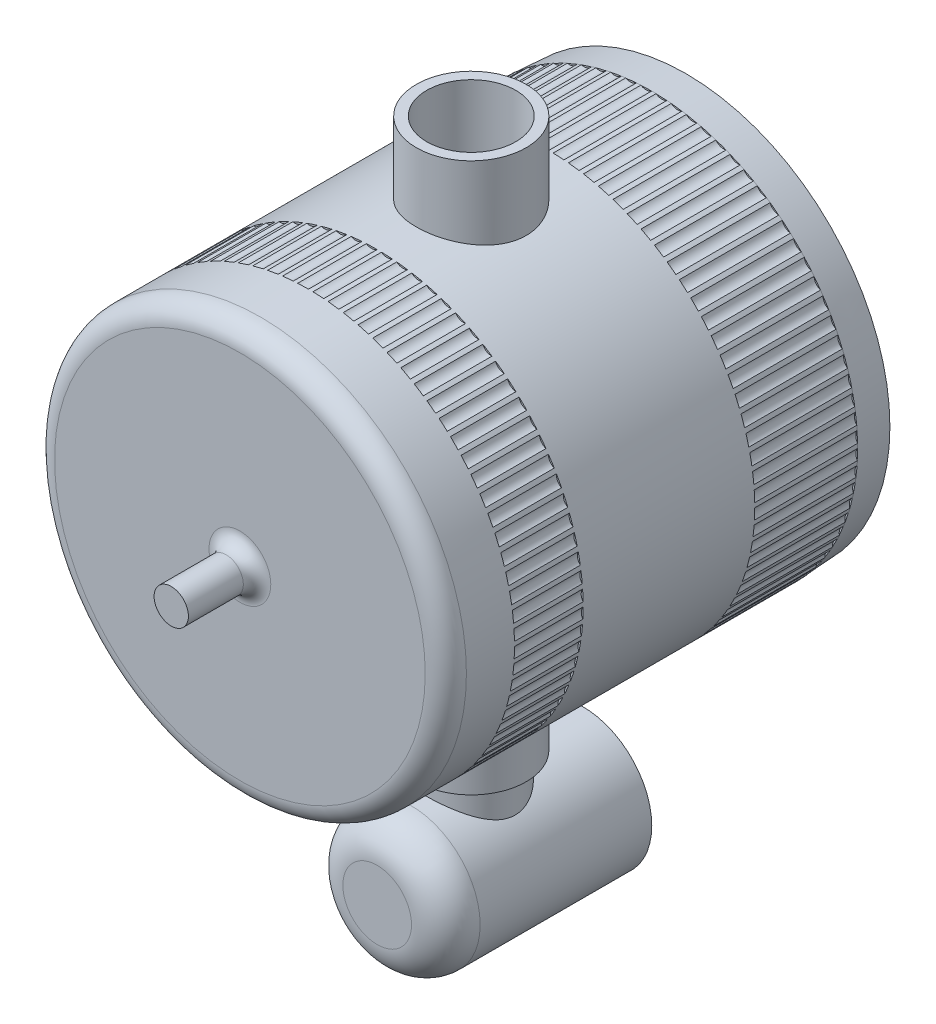
from build123d import *
from build123d.topology import SkipClean

# Parameters (mm, degrees)
BOSS_EXTRUDE1_DEPTH      = 30
SKETCH2_R                = 15
SKETCH2_R_2              = 14.660567804
BOSS_EXTRUDE2_DEPTH      = 2.5
BOSS_EXTRUDE2_DRAFT      = 3.5
BOSS_EXTRUDE3_START      = -5
SKETCH3_R                = 15
BOSS_EXTRUDE3_DEPTH      = 5
BOSS_EXTRUDE4_START      = -22.5
SKETCH3_2_R              = 15
BOSS_EXTRUDE4_DEPTH      = 12.5
BOSS_EXTRUDE5_DEPTH      = 20
BOSS_EXTRUDE5_DEPTH_BACK = 20
SKETCH4_R                = 4
SKETCH4_R_2              = 3.245
SKETCH5_R                = 3.2
BOSS_EXTRUDE6_DEPTH      = 2.5
BOSS_EXTRUDE7_START      = -25
SKETCH7_R                = 5
BOSS_EXTRUDE7_DEPTH      = 15
SKETCH8_R                = 4.25
CUT_EXTRUDE1_DEPTH       = 2.5
CUT_EXTRUDE1_DRAFT       = -10
FILLET2_R                = 2.5
FILLET3_R                = 1.5
SKETCH9_R                = 1.25
BOSS_EXTRUDE8_DEPTH      = 5
FILLET4_R                = 1


with BuildPart() as part:
    # Sketch1 → Boss-Extrude1 (new body)
    with BuildSketch(Plane.XY):
        with BuildLine():
            ThreePointArc((0.315896216, 14.996673284), (0.155641984, 14.999192497), (-0.004630017, 14.999999285))
            ThreePointArc((-0.004630017, 14.999999285), (-0.395348646, 14.868399492), (-0.792508668, 14.979049703))
            ThreePointArc((-0.792508668, 14.979049703), (-0.952511323, 14.969726857), (-1.112405233, 14.95869495))
            ThreePointArc((-1.112405233, 14.95869495), (-1.492337899, 14.798598974), (-1.896585144, 14.879615747))
            ThreePointArc((-1.896585144, 14.879615747), (-2.055462344, 14.85850176), (-2.214104877, 14.835691409))
            ThreePointArc((-2.214104877, 14.835691409), (-2.58117652, 14.64797364), (-2.99030313, 14.69891449))
            ThreePointArc((-2.99030313, 14.69891449), (-3.147187142, 14.666124679), (-3.303711848, 14.631660467))
            ThreePointArc((-3.303711848, 14.631660467), (-3.655917651, 14.417346154), (-4.067689116, 14.437932859))
            ThreePointArc((-4.067689116, 14.437932859), (-4.221723096, 14.39364631), (-4.37527509, 14.347716469))
            ThreePointArc((-4.37527509, 14.347716469), (-4.710691426, 14.107976123), (-5.122858796, 14.098096246))
            ThreePointArc((-5.122858796, 14.098096246), (-5.273201462, 14.042554837), (-5.422942097, 13.98541022))
            ThreePointArc((-5.422942097, 13.98541022), (-5.739737039, 13.721553218), (-6.150049197, 13.681260719))
            ThreePointArc((-6.150049197, 13.681260719), (-6.29587943, 13.614767799), (-6.440990875, 13.546720509))
            ThreePointArc((-6.440990875, 13.546720509), (-6.737434199, 13.260187948), (-7.143650162, 13.189702891))
            ThreePointArc((-7.143650162, 13.189702891), (-7.284171487, 13.11262162), (-7.423861194, 13.034043308))
            ThreePointArc((-7.423861194, 13.034043308), (-7.698333829, 12.72640013), (-8.098234987, 12.62610748))
            ThreePointArc((-8.098234987, 12.62610748), (-8.232679926, 12.538858849), (-8.366184958, 12.450178683))
            ThreePointArc((-8.366184958, 12.450178683), (-8.617187829, 12.123105127), (-9.008590061, 11.993552647))
            ThreePointArc((-9.008590061, 11.993552647), (-9.136224323, 11.896613179), (-9.262815521, 11.798315499))
            ThreePointArc((-9.262815521, 11.798315499), (-9.488977738, 11.453597928), (-9.86974334, 11.29549319))
            ThreePointArc((-9.86974334, 11.29549319), (-9.98986983, 11.189392333), (-10.108855797, 11.082014008))
            ThreePointArc((-10.108855797, 11.082014008), (-10.30894214, 10.721535149), (-10.676991504, 10.535741665))
            ThreePointArc((-10.676991504, 10.535741665), (-10.788954132, 10.421058907), (-10.899685009, 10.305186398))
            ThreePointArc((-10.899685009, 10.305186398), (-11.072602676, 9.930915063), (-11.425925642, 9.718447573))
            ThreePointArc((-11.425925642, 9.718447573), (-11.529112908, 9.59580927), (-11.630983921, 9.472075435))
            ThreePointArc((-11.630983921, 9.472075435), (-11.775788495, 9.086055762), (-12.112455336, 8.84807469))
            ThreePointArc((-12.112455336, 8.84807469), (-12.206303668, 8.718150651), (-12.298758431, 8.587231279))
            ThreePointArc((-12.298758431, 8.587231279), (-12.414659041, 8.191571576), (-12.732831, 7.929376692))
            ThreePointArc((-12.732831, 7.929376692), (-12.816827829, 7.792876516), (-12.899361389, 7.655486645))
            ThreePointArc((-12.899361389, 7.655486645), (-12.985725025, 7.252347866), (-13.283664356, 6.967371188))
            ThreePointArc((-13.283664356, 6.967371188), (-13.357350922, 6.825040392), (-13.429512507, 6.681930397))
            ThreePointArc((-13.429512507, 6.681930397), (-13.485867482, 6.273514347), (-13.761946944, 5.967312318))
            ThreePointArc((-13.761946944, 5.967312318), (-13.824920795, 5.819928264), (-13.886316285, 5.671879762))
            ThreePointArc((-13.886316285, 5.671879762), (-13.912354806, 5.260417069), (-14.16506655, 4.934662058))
            ThreePointArc((-14.16506655, 4.934662058), (-14.216983746, 4.783029706), (-14.267277819, 4.630851287))
            ThreePointArc((-14.267277819, 4.630851287), (-14.262857674, 4.218589216), (-14.490821475, 3.875060385))
            ThreePointArc((-14.490821475, 3.875060385), (-14.531398461, 3.720007899), (-14.570316429, 3.564530708))
            ThreePointArc((-14.570316429, 3.564530708), (-14.535461758, 3.153720892), (-14.737432557, 2.794294476))
            ThreePointArc((-14.737432557, 2.794294476), (-14.766447717, 2.636668698), (-14.793777023, 2.478741898))
            ThreePointArc((-14.793777023, 2.478741898), (-14.728678191, 2.071628038), (-14.903552894, 1.698267099))
            ThreePointArc((-14.903552894, 1.698267099), (-14.920847756, 1.538928928), (-14.936439137, 1.37941506))
            ThreePointArc((-14.936439137, 1.37941506), (-14.841451692, 0.978220671), (-14.988275193, 0.592964377))
            ThreePointArc((-14.988275193, 0.592964377), (-14.993755299, 0.432784061), (-14.9975236, 0.272554334))
            ThreePointArc((-14.9975236, 0.272554334), (-14.873166329, -0.120529399), (-14.99113673, -0.515576912))
            ThreePointArc((-14.99113673, -0.515576912), (-14.984772149, -0.675724523), (-14.97669679, -0.835794988))
            ThreePointArc((-14.97669679, -0.835794988), (-14.82364889, -1.218621179), (-14.912121877, -1.621302298))
            ThreePointArc((-14.912121877, -1.621302298), (-14.893947371, -1.780542533), (-14.874072455, -1.939579488))
            ThreePointArc((-14.874072455, -1.939579488), (-14.693169821, -2.310057273), (-14.751662185, -2.718172693))
            ThreePointArc((-14.751662185, -2.718172693), (-14.721777017, -2.875635838), (-14.690211095, -3.032770677))
            ThreePointArc((-14.690211095, -3.032770677), (-14.482441754, -3.388876635), (-14.51063403, -3.800197371))
            ThreePointArc((-14.51063403, -3.800197371), (-14.469201422, -3.955023416), (-14.426116896, -4.109397925))
            ThreePointArc((-14.426116896, -4.109397925), (-14.192615612, -4.449187128), (-14.190353823, -4.861466689))
            ThreePointArc((-14.190353823, -4.861466689), (-14.137600066, -5.012810029), (-14.083232249, -5.163581066))
            ThreePointArc((-14.083232249, -5.163581066), (-13.825274324, -5.485197704), (-13.792570825, -5.896184362))
            ThreePointArc((-13.792570825, -5.896184362), (-13.728784041, -6.043218411), (-13.663429871, -6.189562518))
            ThreePointArc((-13.663429871, -6.189562518), (-13.382424183, -6.491250032), (-13.319457588, -6.898699121))
            ThreePointArc((-13.319457588, -6.898699121), (-13.244986158, -7.04062083), (-13.169002577, -7.181738726))
            ThreePointArc((-13.169002577, -7.181738726), (-12.866483882, -7.461849403), (-12.773598092, -7.863535577))
            ThreePointArc((-12.773598092, -7.863535577), (-12.688848754, -7.999569819), (-12.602650758, -8.134690767))
            ThreePointArc((-12.602650758, -8.134690767), (-12.280271307, -8.391694741), (-12.157973633, -8.785424129))
            ThreePointArc((-12.157973633, -8.785424129), (-12.063409259, -8.914827932), (-11.96746763, -9.043213949))
            ThreePointArc((-11.96746763, -9.043213949), (-11.626988149, -9.275707551), (-11.475946539, -9.659329741))
            ThreePointArc((-11.475946539, -9.659329741), (-11.372083605, -9.781396347), (-11.266922344, -9.902346231))
            ThreePointArc((-11.266922344, -9.902346231), (-10.910202414, -10.109059664), (-10.731241803, -10.480479443))
            ThreePointArc((-10.731241803, -10.480479443), (-10.618647574, -10.594542166), (-10.504841036, -10.707395333))
            ThreePointArc((-10.504841036, -10.707395333), (-10.133828936, -10.887199598), (-9.927926746, -11.244388401))
            ThreePointArc((-9.927926746, -11.244388401), (-9.807216172, -11.34982427), (-9.685385928, -11.453964354))
            ThreePointArc((-9.685385928, -11.453964354), (-9.302107999, -11.605877424), (-9.070388797, -11.946884409))
            ThreePointArc((-9.070388797, -11.946884409), (-8.942221156, -12.04311757), (-8.813032602, -12.137975793))
            ThreePointArc((-8.813032602, -12.137975793), (-8.419582173, -12.261167972), (-8.163311528, -12.584130677))
            ThreePointArc((-8.163311528, -12.584130677), (-8.028386829, -12.670635537), (-7.892545547, -12.755693818))
            ThreePointArc((-7.892545547, -12.755693818), (-7.49107151, -12.849492271), (-7.211649083, -13.152646787))
            ThreePointArc((-7.211649083, -13.152646787), (-7.070704238, -13.228950887), (-6.928952145, -13.303744667))
            ThreePointArc((-6.928952145, -13.303744667), (-6.521647211, -13.3676371), (-6.220599112, -13.649327701))
            ThreePointArc((-6.220599112, -13.649327701), (-6.074403912, -13.715014295), (-5.92751521, -13.779135076))
            ThreePointArc((-5.92751521, -13.779135076), (-5.516603937, -13.812772531), (-5.195574385, -14.07146072))
            ThreePointArc((-5.195574385, -14.07146072), (-5.044927298, -14.126171051), (-4.893704242, -14.179268627))
            ThreePointArc((-4.893704242, -14.179268627), (-4.481430885, -14.182467388), (-4.142173233, -14.416740301))
            ThreePointArc((-4.142173233, -14.416740301), (-3.98789704, -14.460175559), (-3.833165558, -14.50195993))
            ThreePointArc((-3.833165558, -14.50195993), (-3.421781812, -14.474702526), (-3.066148967, -14.683280645))
            ThreePointArc((-3.066148967, -14.683280645), (-2.909086272, -14.715203602), (-2.751691453, -14.745446556))
            ThreePointArc((-2.751691453, -14.745446556), (-2.343444153, -14.687881859), (-1.973378458, -14.869626003))
            ThreePointArc((-1.973378458, -14.869626003), (-1.814387084, -14.889862307), (-1.655188564, -14.908398667))
            ThreePointArc((-1.655188564, -14.908398667), (-1.252307415, -14.820841074), (-0.869830041, -14.974758619))
            ThreePointArc((-0.869830041, -14.974758619), (-0.709778342, -14.983197746), (-0.549645609, -14.989926274))
            ThreePointArc((-0.549645609, -14.989926274), (-0.154331008, -14.872853994), (0.238469086, -14.998104297))
            ThreePointArc((0.238469086, -14.998104297), (0.398706963, -14.994700156), (0.55889932, -14.989584102))
            ThreePointArc((0.55889932, -14.989584102), (0.944488301, -14.843636544), (1.345465778, -14.93953553))
            ThreePointArc((1.345465778, -14.93953553), (1.505014668, -14.924306712), (1.664391734, -14.907374019))
            ThreePointArc((1.664391734, -14.907374019), (2.038149143, -14.733348298), (2.445114003, -14.7993722))
            ThreePointArc((2.445114003, -14.7993722), (2.603102506, -14.772401881), (2.760793818, -14.743745029))
            ThreePointArc((2.760793818, -14.743745029), (3.120678321, -14.542591613), (3.531407862, -14.578379831))
            ThreePointArc((3.531407862, -14.578379831), (3.6869731, -14.539815314), (3.842117404, -14.499590817))
            ThreePointArc((3.842117404, -14.499590817), (4.186163436, -14.272408335), (4.598414397, -14.277765408))
            ThreePointArc((4.598414397, -14.277765408), (4.750706726, -14.227817317), (4.902456677, -14.176244867))
            ThreePointArc((4.902456677, -14.176244867), (5.228785179, -13.924274112), (5.640305986, -13.89917078))
            ThreePointArc((5.640305986, -13.89917078), (5.788493639, -13.838111916), (5.936020431, -13.775473184))
            ThreePointArc((5.936020431, -13.775473184), (6.242849109, -13.500090333), (6.65139218, -13.444663702))
            ThreePointArc((6.65139218, -13.444663702), (6.794665807, -13.372827546), (6.9371637, -13.299464643))
            ThreePointArc((6.9371637, -13.299464643), (7.222816763, -13.002173742), (7.626150777, -12.916726533))
            ThreePointArc((7.626150777, -12.916726533), (7.763727866, -12.83450543), (7.900418587, -12.750819038))
            ThreePointArc((7.900418587, -12.750819038), (8.163335896, -12.433243786), (8.559257983, -12.318242682))
            ThreePointArc((8.559257983, -12.318242682), (8.690387136, -12.226085695), (8.820524127, -12.132532882))
            ThreePointArc((8.820524127, -12.132532882), (9.05926972, -11.796407764), (9.445617489, -11.652480862))
            ThreePointArc((9.445617489, -11.652480862), (9.569582526, -11.55089132), (9.692455023, -11.447983038))
            ThreePointArc((9.692455023, -11.447983038), (9.905724953, -11.095143854), (10.280388309, -10.923077232))
            ThreePointArc((10.280388309, -10.923077232), (10.396512173, -10.812609982), (10.511449091, -10.70090828))
            ThreePointArc((10.511449091, -10.70090828), (10.698078552, -10.333282116), (11.059011212, -10.134015542))
            ThreePointArc((11.059011212, -10.134015542), (11.166659677, -10.015273918), (11.273033268, -9.895388872))
            ThreePointArc((11.273033268, -9.895388872), (11.432002956, -9.514983574), (11.777233631, -9.289605373))
            ThreePointArc((11.777233631, -9.289605373), (11.875818758, -9.163237901), (11.973048048, -9.035824281))
            ThreePointArc((11.973048048, -9.035824281), (12.103489724, -8.644717491), (12.431132884, -8.394458601))
            ThreePointArc((12.431132884, -8.394458601), (12.520116235, -8.261155456), (12.607670191, -8.126909152))
            ThreePointArc((12.607670191, -8.126909152), (12.708871428, -7.727236959), (13.0171376, -7.453464208))
            ThreePointArc((13.0171376, -7.453464208), (13.096033178, -7.313953445), (13.173433611, -7.173607663))
            ThreePointArc((13.173433611, -7.173607663), (13.244841684, -6.767552938), (13.532047225, -6.471761577))
            ThreePointArc((13.532047225, -6.471761577), (13.60042413, -6.326805156), (13.667248305, -6.181126417))
            ThreePointArc((13.667248305, -6.181126417), (13.708473207, -5.77090689), (13.9730495, -5.454712429))
            ThreePointArc((13.9730495, -5.454712429), (14.030534282, -5.305102051), (14.086417228, -5.154886001))
            ThreePointArc((14.086417228, -5.154886001), (14.097233803, -4.74274215), (14.337735824, -4.407871533))
            ThreePointArc((14.337735824, -4.407871533), (14.38401452, -4.254424319), (14.428651025, -4.100491386))
            ThreePointArc((14.428651025, -4.100491386), (14.409000197, -3.688674197), (14.624114407, -3.336956371))
            ThreePointArc((14.624114407, -3.336956371), (14.658934259, -3.180510396), (14.692080533, -3.023701309))
            ThreePointArc((14.692080533, -3.023701309), (14.642069628, -2.614459984), (14.830621148, -2.247815911))
            ThreePointArc((14.830621148, -2.247815911), (14.853791983, -2.089225628), (14.875266993, -1.930396824))
            ThreePointArc((14.875266993, -1.930396824), (14.795169152, -1.525966498), (14.956128179, -1.146398659))
            ThreePointArc((14.956128179, -1.146398659), (14.967523446, -0.986530235), (14.977209902, -0.82654918))
            ThreePointArc((14.977209902, -0.82654918), (14.867462593, -0.429138712), (14.999950025, -0.038720176))
            ThreePointArc((14.999950025, -0.038720176), (14.999507486, 0.121553245), (14.997352485, 0.281812788))
            ThreePointArc((14.997352485, 0.281812788), (14.858555109, 0.670032881), (14.961847345, 1.069169783))
            ThreePointArc((14.961847345, 1.069169783), (14.949569417, 1.228972842), (14.935584729, 1.388635592))
            ThreePointArc((14.935584729, 1.388635592), (14.76849535, 1.765544987), (14.842028243, 2.171220308))
            ThreePointArc((14.842028243, 2.171220308), (14.817981984, 2.329680217), (14.792243988, 2.487874151))
            ThreePointArc((14.792243988, 2.487874151), (14.59777519, 2.851414299), (14.64114713, 3.26141238))
            ThreePointArc((14.64114713, 3.26141238), (14.605463873, 3.417663686), (14.568113141, 3.573524804))
            ThreePointArc((14.568113141, 3.573524804), (14.347327044, 3.921710174), (14.360301148, 4.333791749))
            ThreePointArc((14.360301148, 4.333791749), (14.313175782, 4.486981061), (14.264416311, 4.639658103))
            ThreePointArc((14.264416311, 4.639658103), (14.018518773, 4.970587028), (14.001024182, 5.382501451))
            ThreePointArc((14.001024182, 5.382501451), (13.942714088, 5.531792101), (13.882812186, 5.680451199))
            ThreePointArc((13.882812186, 5.680451199), (13.613146214, 5.992316259), (13.565278476, 6.401813796))
            ThreePointArc((13.565278476, 6.401813796), (13.496102126, 6.546390411), (13.425384954, 6.69021964))
            ThreePointArc((13.425384954, 6.69021964), (13.133423371, 6.981317538), (13.055443923, 7.386161653))
            ThreePointArc((13.055443923, 7.386161653), (12.975779133, 7.525234607), (12.894632926, 7.663448421))
            ThreePointArc((12.894632926, 7.663448421), (12.581970323, 7.93218928), (12.474305063, 8.330168858))
            ThreePointArc((12.474305063, 8.330168858), (12.384586934, 8.462978581), (12.293454884, 8.594822105))
            ThreePointArc((12.293454884, 8.594822105), (11.961798917, 8.839738156), (11.825035874, 9.228679568))
            ThreePointArc((11.825035874, 9.228679568), (11.725754417, 9.354500701), (11.625134255, 9.47925385))
            ThreePointArc((11.625134255, 9.47925385), (11.276296313, 9.699007447), (11.11118244, 10.076786431))
            ThreePointArc((11.11118244, 10.076786431), (11.002879894, 10.194931782), (10.893321173, 10.311913198))
            ThreePointArc((10.893321173, 10.311913198), (10.529206489, 10.505304122), (10.336643581, 10.869857381))
            ThreePointArc((10.336643581, 10.869857381), (10.219911458, 10.97968168), (10.102012549, 11.088252453))
            ThreePointArc((10.102012549, 11.088252453), (9.724609791, 11.25422447), (9.505649558, 11.603560939))
            ThreePointArc((9.505649558, 11.603560939), (9.381125408, 11.704464365), (9.255530236, 11.804031517))
            ThreePointArc((9.255530236, 11.804031517), (8.866900646, 11.941678146), (8.622738975, 12.273889871))
            ThreePointArc((8.622738975, 12.273889871), (8.491102905, 12.365321324), (8.358497425, 12.455341055))
            ThreePointArc((8.358497425, 12.455341055), (7.960763564, 12.563910517), (7.692733981, 12.877183073))
            ThreePointArc((7.692733981, 12.877183073), (7.554704943, 12.958643186), (7.415813401, 13.038623839))
            ThreePointArc((7.415813401, 13.038623839), (7.011147553, 13.117523165), (6.720713941, 13.410145567))
            ThreePointArc((6.720713941, 13.410145567), (6.577045802, 13.481189433), (6.432626775, 13.550694181))
            ThreePointArc((6.432626775, 13.550694181), (6.023239084, 13.599492451), (5.711987693, 13.869866495))
            ThreePointArc((5.711987693, 13.869866495), (5.563465117, 13.930106098), (5.414307372, 13.98875533))
            ThreePointArc((5.414307372, 13.98875533), (5.002433773, 14.007186025), (4.672064548, 14.253835023))
            ThreePointArc((4.672064548, 14.253835023), (4.519498715, 14.302941354), (4.3664169, 14.350414749))
            ThreePointArc((4.3664169, 14.350414749), (3.954306903, 14.338377207), (3.606624207, 14.559954046))
            ThreePointArc((3.606624207, 14.559954046), (3.450848378, 14.597658904), (3.294678573, 14.633697178))
            ThreePointArc((3.294678573, 14.633697178), (2.88458298, 14.591257144), (2.521485736, 14.78655165))
            ThreePointArc((2.521485736, 14.78655165), (2.363350704, 14.812649103), (2.204945854, 14.837055428))
            ThreePointArc((2.204945854, 14.837055428), (1.799104464, 14.764444694), (1.422575784, 14.932390235))
            ThreePointArc((1.422575784, 14.932390235), (1.262945229, 14.946737749), (1.103170486, 14.959378827))
            ThreePointArc((1.103170486, 14.959378827), (0.703799865, 14.856993967), (0.315896216, 14.996673284))
        make_face()
    extrude(amount=BOSS_EXTRUDE1_DEPTH)

    # Sketch3 → Boss-Extrude3 (add)
    with BuildSketch(Plane.XY.offset(30).offset(BOSS_EXTRUDE3_START)):
        Circle(SKETCH3_R)
    extrude(amount=BOSS_EXTRUDE3_DEPTH)

    # Sketch3<2> → Boss-Extrude4 (add)
    with SkipClean():  # the faces are left unmerged after this step: merging them gives an invalid solid
        with BuildSketch(Plane.XY.offset(30).offset(BOSS_EXTRUDE4_START)):
            Circle(SKETCH3_2_R)
        extrude(amount=BOSS_EXTRUDE4_DEPTH)

    # Sketch4 → Boss-Extrude5 (add, two sides: drawn at the far end of the back side and taken through both)
    with SkipClean():  # the faces are left unmerged after this step: merging them gives an invalid solid
        with BuildSketch(Plane(origin=(0, 0, 0), x_dir=(1, 0, 0), z_dir=(0, 1, 0)).offset(-BOSS_EXTRUDE5_DEPTH_BACK)):
            with Locations((0, -13.147952723)):
                Circle(SKETCH4_R)
            with Locations((0, -13.147952723)):
                Circle(SKETCH4_R_2, mode=Mode.SUBTRACT)
        extrude(amount=BOSS_EXTRUDE5_DEPTH + BOSS_EXTRUDE5_DEPTH_BACK)

    # Fillet3
    fillet3_edges = [part.edges().sort_by_distance(p)[0] for p in [
        (-6.65139218, 13.444663702, 30),
    ]]
    fillet(fillet3_edges, radius=FILLET3_R)

    # Sketch9 → Boss-Extrude8 (add)
    with SkipClean():  # the faces are left unmerged after this step: merging them gives an invalid solid
        with BuildSketch(Plane.XY.offset(30)):
            Circle(SKETCH9_R)
        extrude(amount=BOSS_EXTRUDE8_DEPTH)

    # Fillet4
    fillet4_edges = [part.edges().sort_by_distance(p)[0] for p in [
        (-1.25, 0, 30),
    ]]
    fillet(fillet4_edges, radius=FILLET4_R)


with BuildPart() as body_2:
    # Sketch2 → Boss-Extrude2 (with draft: the straight prism first)
    with BuildSketch(Plane(origin=(0, 0, 0), x_dir=(-1, 0, 0), z_dir=(0, 0, -1))):
        Circle(SKETCH2_R)
        Circle(SKETCH2_R_2, mode=Mode.SUBTRACT)
    extrude(amount=BOSS_EXTRUDE2_DEPTH)
    # Boss-Extrude2: the draft: its side faces are tilted about the plane it starts from
    boss_extrude2_sides = [body_2.faces().sort_by_distance(p)[0] for p in [
        (15, 0, -1.25),
        (14.660567804, 0, -1.25),
    ]]
    draft(boss_extrude2_sides, Plane(origin=(0, 0, 0), x_dir=(-1, 0, 0), z_dir=(0, 0, -1)), BOSS_EXTRUDE2_DRAFT)


with BuildPart() as body_3:
    # Sketch5 → Boss-Extrude6 (new body)
    with BuildSketch(Plane.XZ.offset(20)):
        with Locations((0, 13.147952723)):
            Circle(SKETCH5_R)
    extrude(amount=BOSS_EXTRUDE6_DEPTH)

    # Sketch7 → Boss-Extrude7 (add)
    with BuildSketch(Plane.XY.offset(30).offset(BOSS_EXTRUDE7_START)):
        with Locations((0, -26.341874542)):
            Circle(SKETCH7_R)
    extrude(amount=BOSS_EXTRUDE7_DEPTH)


with BuildPart() as cut_extrude1_tool:
    # Sketch8 → Cut-Extrude1 (with draft: the straight prism first)
    with BuildSketch(Plane(origin=(0, 0, 5), x_dir=(-1, 0, 0), z_dir=(0, 0, -1))):
        with Locations((0, -26.341874542)):
            Circle(SKETCH8_R)
    extrude(amount=-CUT_EXTRUDE1_DEPTH)
    # Cut-Extrude1: the draft: its side faces are tilted about the plane it starts from
    cut_extrude1_sides = [cut_extrude1_tool.faces().sort_by_distance(p)[0] for p in [
        (4.25, -26.341874542, 6.25),
    ]]
    draft(cut_extrude1_sides, Plane(origin=(0, 0, 5), x_dir=(-1, 0, 0), z_dir=(0, 0, -1)), CUT_EXTRUDE1_DRAFT)


with BuildPart() as body_3_1:
    add(body_3.part)

    # Cut-Extrude1: cut by cut_extrude1_tool
    add(cut_extrude1_tool.part, mode=Mode.SUBTRACT)

    # Fillet2
    fillet2_edges = [body_3_1.edges().sort_by_distance(p)[0] for p in [
        (-5, -26.341874542, 20),
    ]]
    fillet(fillet2_edges, radius=FILLET2_R)


solid = Compound([part.part, body_2.part, body_3_1.part])
